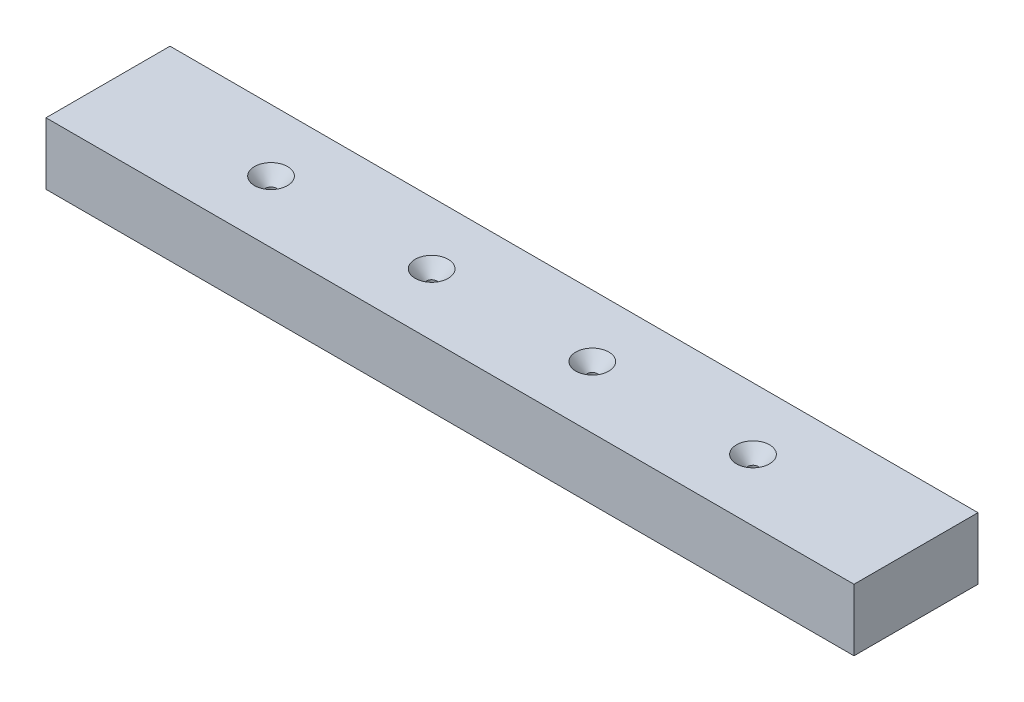
from build123d import *

# Parameters (mm, degrees)
SKETCH1_W           = 248.25
SKETCH1_H           = 19.05
BOSS_EXTRUDE1_DEPTH = 38.1
HOLE1_D             = 3.175
HOLE1_DEPTH         = 31.75
HOLE1_CSINK_D       = 10.16
HOLE1_CSINK_ANGLE   = 82
HOLE1_TIP           = 0.953866233
HOLE2_D             = 3.175
HOLE2_DEPTH         = 57.15
HOLE2_CSINK_D       = 10.16
HOLE2_CSINK_ANGLE   = 82
HOLE2_TIP           = 0.953866233


with BuildPart() as part:
    # Sketch1 → Boss-Extrude1 (new body)
    with BuildSketch(Plane.XY):
        with Locations((124.125, 47.625)):
            Rectangle(SKETCH1_W, SKETCH1_H)
    extrude(amount=BOSS_EXTRUDE1_DEPTH)

    # Hole1
    with Locations(Plane(origin=(-1090.512770337, -52.974999997, -12.7), x_dir=(0, 1, 0), z_dir=(0, 0, -1))):
        with Locations((-100.332047386, 1313.362770337), (100.599999997, 1313.362770337), (100.599999997, 1115.912770337), (100.599999997, 1214.637770337), (-100.332047386, 1214.637770337), (-100.332047386, 1115.912770337)):
            CounterSinkHole(HOLE1_D / 2, HOLE1_CSINK_D / 2, depth=HOLE1_DEPTH, counter_sink_angle=HOLE1_CSINK_ANGLE)
            with Locations((0, 0, -(HOLE1_DEPTH + HOLE1_TIP / 2))):  # 118° drill point
                Cone(0, HOLE1_D / 2, HOLE1_TIP, mode=Mode.SUBTRACT)

    # Hole2
    with Locations(Plane(origin=(-1090.512770337, 57.15, -415.792401694), x_dir=(0.3746065934159092, 0, 0.9271838545667885), z_dir=(0, 1, 0))):
        with Locations((848.944412528, 940.413642522), (885.927448463, 1031.949868564), (867.435930496, 986.181755543), (830.452894561, 894.645529501)):
            CounterSinkHole(HOLE2_D / 2, HOLE2_CSINK_D / 2, depth=HOLE2_DEPTH, counter_sink_angle=HOLE2_CSINK_ANGLE)
            with Locations((0, 0, -(HOLE2_DEPTH + HOLE2_TIP / 2))):  # 118° drill point
                Cone(0, HOLE2_D / 2, HOLE2_TIP, mode=Mode.SUBTRACT)


solid = part.part
